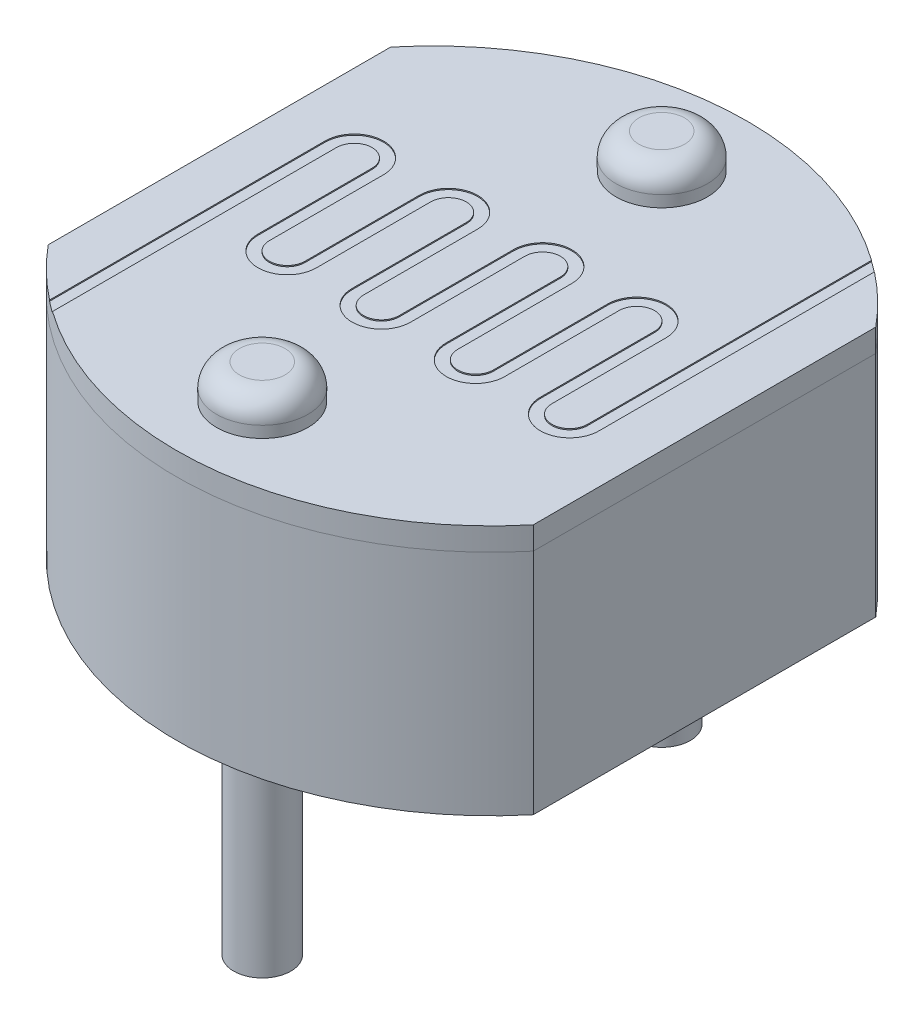
from build123d import *

# Parameters (mm, degrees)
BOSS_EXTRUDE1_DEPTH     = 2
BOSS_EXTRUDE2_DEPTH     = 0.2
SKETCH3_R               = 0.4
BOSS_EXTRUDE4_DEPTH     = 2.5
SKETCH4_R               = 0.25
BOSS_EXTRUDE5_DEPTH     = 2
FILLET1_R               = 0.5
FILLET2_R               = 0.2
CUT_EXTRUDE_THIN1_DEPTH = 0.01


with BuildPart() as part:
    # Sketch1 → Boss-Extrude1 (new body)
    with BuildSketch(Plane(origin=(0, 0, 0), x_dir=(1, 0, 0), z_dir=(0, 1, 0))):
        with BuildLine():
            Line((-2.125, 1.5), (-2.125, -1.5))
            ThreePointArc((-2.125, -1.5), (0, -2.5), (2.125, -1.5))
            Line((2.125, -1.5), (2.125, 1.5))
            ThreePointArc((2.125, 1.5), (0, 2.5), (-2.125, 1.5))
        make_face()
    extrude(amount=BOSS_EXTRUDE1_DEPTH)


with BuildPart() as body_2:
    # Sketch2 → Boss-Extrude2 (new body)
    with BuildSketch(Plane(origin=(0, 2, 0), x_dir=(1, 0, 0), z_dir=(0, 1, 0))):
        with BuildLine():
            Line((-2.125, 1.5), (-2.125, -1.5))
            ThreePointArc((-2.125, -1.5), (0, -2.5), (2.125, -1.5))
            Line((2.125, -1.5), (2.125, 1.5))
            ThreePointArc((2.125, 1.5), (0, 2.5), (-2.125, 1.5))
        make_face()
    extrude(amount=BOSS_EXTRUDE2_DEPTH)

    # Sketch3 → Boss-Extrude4 (add)
    with BuildSketch(Plane.XZ):
        with Locations(Location((0, 1.75, 0), (0, 0, 270))):
            Circle(SKETCH3_R)
        with Locations(Location((0, -1.75, 0), (0, 0, 270))):
            Circle(SKETCH3_R)
    extrude(amount=-BOSS_EXTRUDE4_DEPTH)

    # Sketch4 → Boss-Extrude5 (add)
    with BuildSketch(Plane.XZ):
        with Locations(Location((0, 1.75, 0), (0, 0, 270))):
            Circle(SKETCH4_R)
        with Locations(Location((0, -1.75, 0), (0, 0, 270))):
            Circle(SKETCH4_R)
    extrude(amount=BOSS_EXTRUDE5_DEPTH)

    # Fillet1
    # the kernel refuses this fillet: 0.5 mm, written as the material it adds along each edge
    with BuildSketch(Plane(origin=(0, 0, 1.75), x_dir=(0, 0, -1), z_dir=(-1, 0, 0))) as fillet1_piece_1:
        with BuildLine():
            CenterArc((0.75, 0.357071421), FILLET1_R, 180, 45.572995999)
            Line((0.25, 0.357071421), (0.24, 0.357071421))
            Line((0.24, 0.357071421), (0.24, 0))
            Line((0.24, 0), (0.25, -0.01))
            ThreePointArc((0.25, -0.01), (0.325, -0.01), (0.393, -0.007141428))
            Line((0.393, -0.007141428), (0.4, 0))
        make_face()
    revolve(axis=Axis((0, 0, 1.75), (0, -1, 0)))
    with BuildSketch(Plane(origin=(0, 0, -1.75), x_dir=(0, 0, -1), z_dir=(-1, 0, 0))) as fillet1_piece_2:
        with BuildLine():
            CenterArc((0.75, 0.357071421), FILLET1_R, 180, 45.572995999)
            Line((0.25, 0.357071421), (0.24, 0.357071421))
            Line((0.24, 0.357071421), (0.24, 0))
            Line((0.24, 0), (0.25, -0.01))
            ThreePointArc((0.25, -0.01), (0.325, -0.01), (0.393, -0.007141428))
            Line((0.393, -0.007141428), (0.4, 0))
        make_face()
    revolve(axis=Axis((0, 0, -1.75), (0, -1, 0)))

    # Fillet2
    fillet2_edges = [body_2.edges().sort_by_distance(p)[0] for p in [
        (0, 2.5, 2.15),
        (0, 2.5, -1.35),
    ]]
    fillet(fillet2_edges, radius=FILLET2_R)

    # Sketch5 → Cut-Extrude-Thin1 (cut)
    with BuildSketch(Plane(origin=(0, 2.2, 0), x_dir=(1, 0, 0), z_dir=(0, 1, 0))):
        with BuildLine():
            Line((1.6, 2.5), (1.6, 1.951945357))
            Line((1.6, 1.951945357), (1.6, -0.5))
            ThreePointArc((1.6, -0.5), (1.44375, -0.65625), (1.2875, -0.5))
            Line((1.2875, -0.5), (1.2875, 0.5))
            ThreePointArc((1.2875, 0.5), (1.03125, 0.75625), (0.775, 0.5))
            Line((0.775, 0.5), (0.775, -0.5))
            ThreePointArc((0.775, -0.5), (0.61875, -0.65625), (0.4625, -0.5))
            Line((0.4625, -0.5), (0.4625, 0.5))
            ThreePointArc((0.4625, 0.5), (0.20625, 0.75625), (-0.05, 0.5))
            Line((-0.05, 0.5), (-0.05, -0.5))
            ThreePointArc((-0.05, -0.5), (-0.20625, -0.65625), (-0.3625, -0.5))
            Line((-0.3625, -0.5), (-0.3625, 0.5))
            ThreePointArc((-0.3625, 0.5), (-0.61875, 0.75625), (-0.875, 0.5))
            Line((-0.875, 0.5), (-0.875, -0.5))
            ThreePointArc((-0.875, -0.5), (-1.03125, -0.65625), (-1.1875, -0.5))
            Line((-1.1875, -0.5), (-1.1875, 0.5))
            ThreePointArc((-1.1875, 0.5), (-1.44375, 0.75625), (-1.7, 0.5))
            Line((-1.7, 0.5), (-1.7, -1.951945357))
            Line((-1.7, -1.951945357), (-1.7, -2.5))
            Line((-1.7, -2.5), (-1.6, -2.5))
            Line((-1.6, -2.5), (-1.6, -1.951945357))
            Line((-1.6, -1.951945357), (-1.6, 0.5))
            ThreePointArc((-1.6, 0.5), (-1.44375, 0.65625), (-1.2875, 0.5))
            Line((-1.2875, 0.5), (-1.2875, -0.5))
            ThreePointArc((-1.2875, -0.5), (-1.03125, -0.75625), (-0.775, -0.5))
            Line((-0.775, -0.5), (-0.775, 0.5))
            ThreePointArc((-0.775, 0.5), (-0.61875, 0.65625), (-0.4625, 0.5))
            Line((-0.4625, 0.5), (-0.4625, -0.5))
            ThreePointArc((-0.4625, -0.5), (-0.20625, -0.75625), (0.05, -0.5))
            Line((0.05, -0.5), (0.05, 0.5))
            ThreePointArc((0.05, 0.5), (0.20625, 0.65625), (0.3625, 0.5))
            Line((0.3625, 0.5), (0.3625, -0.5))
            ThreePointArc((0.3625, -0.5), (0.61875, -0.75625), (0.875, -0.5))
            Line((0.875, -0.5), (0.875, 0.5))
            ThreePointArc((0.875, 0.5), (1.03125, 0.65625), (1.1875, 0.5))
            Line((1.1875, 0.5), (1.1875, -0.5))
            ThreePointArc((1.1875, -0.5), (1.44375, -0.75625), (1.7, -0.5))
            Line((1.7, -0.5), (1.7, 1.951945357))
            Line((1.7, 1.951945357), (1.7, 2.5))
            Line((1.7, 2.5), (1.6, 2.5))
        make_face()
    extrude(amount=-CUT_EXTRUDE_THIN1_DEPTH, mode=Mode.SUBTRACT)


solid = Compound([part.part, body_2.part])
